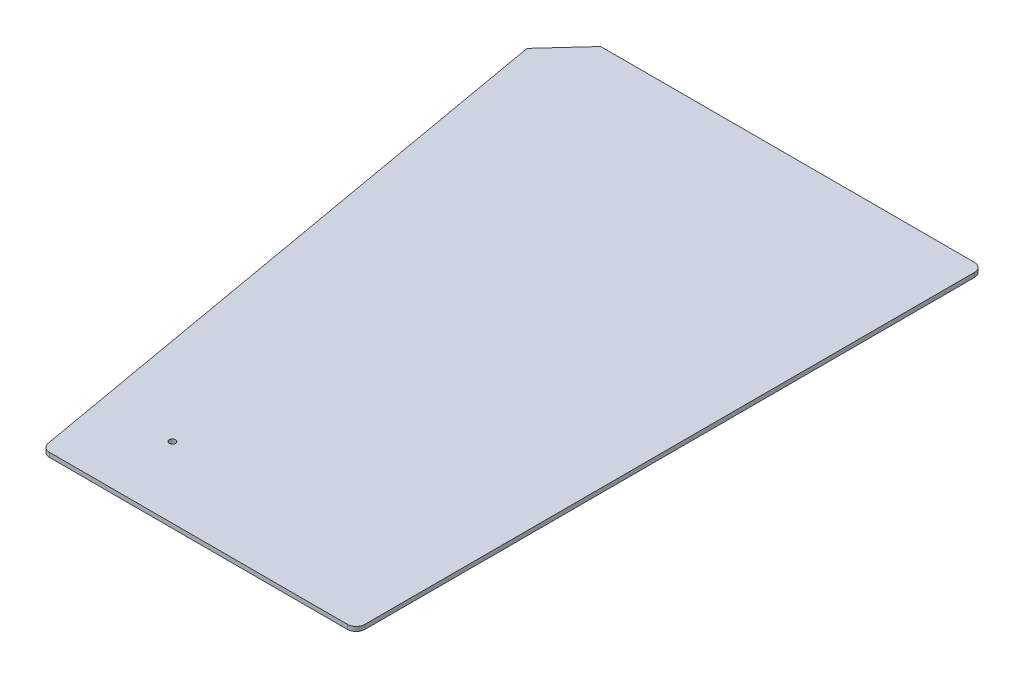
from build123d import *

# Parameters (mm, degrees)
STOCK_TO_SIZE_DEPTH = 3.175
SKETCH2_R           = 2.286
MOUNTING_HOLE_DEPTH = 310.883239542


with BuildPart() as part:
    # Sketch1 → Stock to Size (new body)
    with BuildSketch(Plane(origin=(0, 0, 0), x_dir=(1, 0, 0), z_dir=(0, 1, 0))):
        with BuildLine():
            Line((-90.499742078, -191.417124958), (123.230028435, -191.417124958))
            ThreePointArc((123.230028435, -191.417124958), (127.720156496, -189.557253018), (129.580028435, -185.067124958))
            Line((129.580028435, -185.067124958), (129.580028435, 252.486979719))
            ThreePointArc((129.580028435, 252.486979719), (127.720156496, 256.97710778), (123.230028435, 258.836979719))
            Line((123.230028435, 258.836979719), (-145.075277173, 258.836979719))
            Line((-145.075277173, 258.836979719), (-170.35539162, 231.248575916))
            Line((-170.35539162, 231.248575916), (-96.753271309, -186.169790886))
            ThreePointArc((-96.753271309, -186.169790886), (-94.581443399, -189.931507172), (-90.499742078, -191.417124958))
        make_face()
    extrude(amount=STOCK_TO_SIZE_DEPTH)

    # Sketch2 → Mounting Hole (cut, through all)
    with BuildSketch(Plane(origin=(0, 3.175, 0), x_dir=(1, 0, 0), z_dir=(0, 1, 0))):
        with Locations((-53.201763472, -140.617124958)):
            Circle(SKETCH2_R)
    extrude(amount=-MOUNTING_HOLE_DEPTH, mode=Mode.SUBTRACT)


solid = part.part
